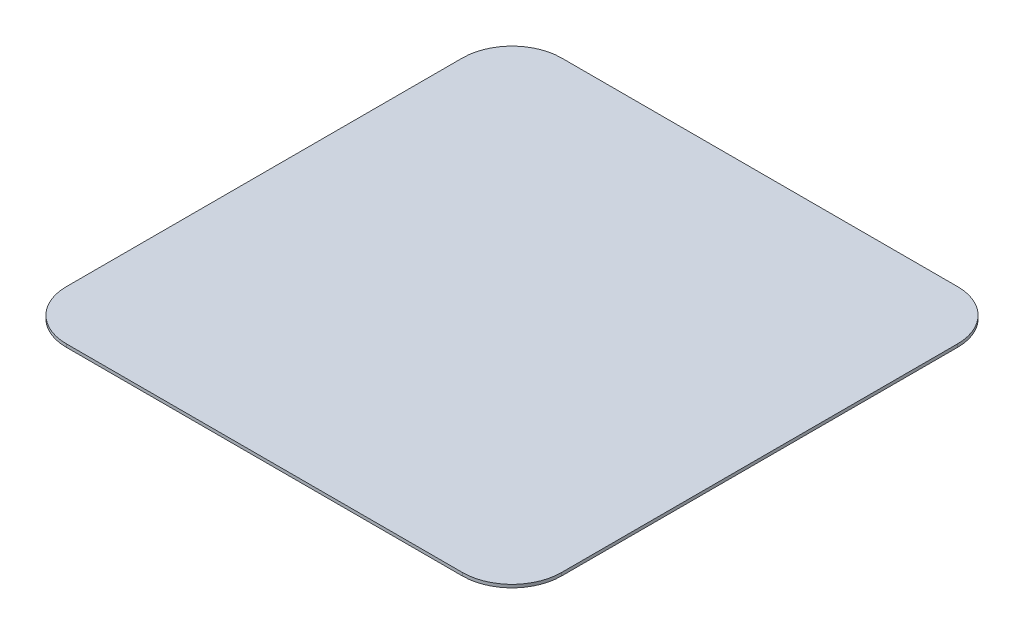
from build123d import *

# Parameters (mm, degrees)
MAINBODY_DEPTH = 0.79375


with BuildPart() as part:
    # Sketch1 → MainBody (new body)
    with BuildSketch(Plane(origin=(0, 25.019326354, 0), x_dir=(1, 0, 0), z_dir=(0, 1, 0))):
        with BuildLine():
            Line((60.280806561, -36.565564287), (60.280806561, 65.034435713))
            ThreePointArc((60.280806561, 65.034435713), (56.561062682, 74.014691834), (47.580806561, 77.734435713))
            Line((47.580806561, 77.734435713), (-54.019193439, 77.734435713))
            ThreePointArc((-54.019193439, 77.734435713), (-62.99944956, 74.014691834), (-66.719193439, 65.034435713))
            Line((-66.719193439, 65.034435713), (-66.719193439, -36.565564287))
            ThreePointArc((-66.719193439, -36.565564287), (-62.99944956, -45.545820408), (-54.019193439, -49.265564287))
            Line((-54.019193439, -49.265564287), (47.580806561, -49.265564287))
            ThreePointArc((47.580806561, -49.265564287), (56.561062682, -45.545820408), (60.280806561, -36.565564287))
        make_face()
    extrude(amount=MAINBODY_DEPTH)


solid = part.part
